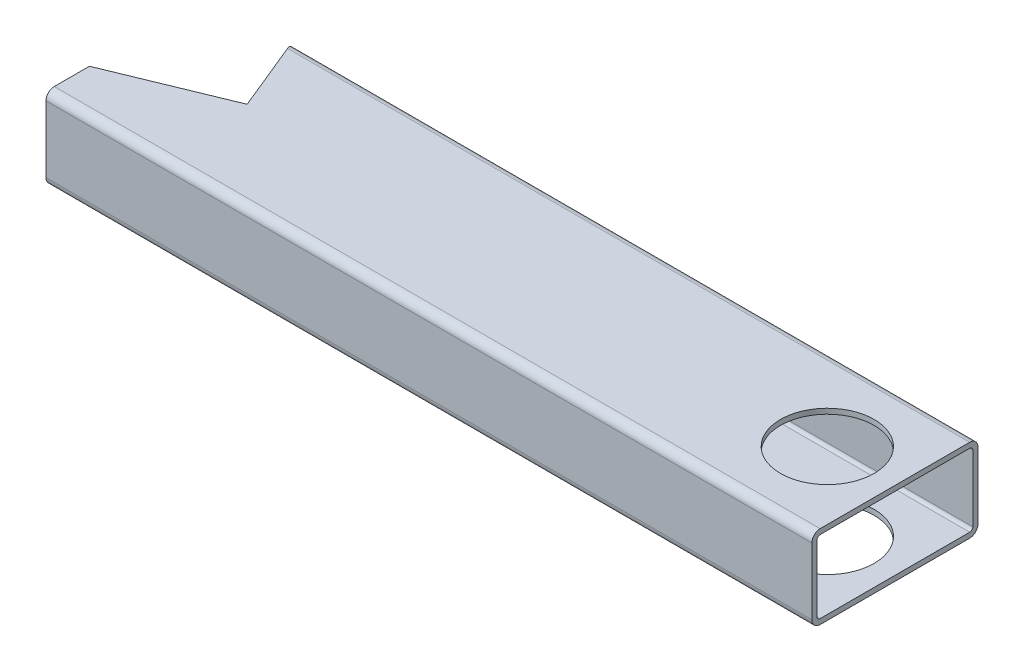
from build123d import *

# Parameters (mm, degrees)
EXTRUDE_THIN1_DEPTH     = 243.6368
CUT_EXTRUDE1_DEPTH      = 251.169323288
CUT_EXTRUDE1_DEPTH_BACK = 251.169323288
SKETCH4_R               = 14.3129


with BuildPart() as part:
    # Sketch1 → Extrude-Thin1 (new body)
    with BuildSketch(Plane(origin=(0, 0, 0), x_dir=(0, 0, -1), z_dir=(1, 0, 0))):
        with BuildLine():
            Line((-48.26, 25.4), (-2.54, 25.4))
            ThreePointArc((-2.54, 25.4), (-0.743948776, 24.656051224), (0, 22.86))
            Line((0, 22.86), (0, 2.54))
            ThreePointArc((0, 2.54), (-0.743948776, 0.743948776), (-2.54, 0))
            Line((-2.54, 0), (-48.26, 0))
            ThreePointArc((-48.26, 0), (-50.056051224, 0.743948776), (-50.8, 2.54))
            Line((-50.8, 2.54), (-50.8, 22.86))
            ThreePointArc((-50.8, 22.86), (-50.056051224, 24.656051224), (-48.26, 25.4))
        make_face()
        with BuildLine():
            Line((-48.26, 23.8125), (-2.54, 23.8125))
            ThreePointArc((-2.54, 23.8125), (-1.866480791, 23.533519209), (-1.5875, 22.86))
            Line((-1.5875, 22.86), (-1.5875, 2.54))
            ThreePointArc((-1.5875, 2.54), (-1.866480791, 1.866480791), (-2.54, 1.5875))
            Line((-2.54, 1.5875), (-48.26, 1.5875))
            ThreePointArc((-48.26, 1.5875), (-48.933519209, 1.866480791), (-49.2125, 2.54))
            Line((-49.2125, 2.54), (-49.2125, 22.86))
            ThreePointArc((-49.2125, 22.86), (-48.933519209, 23.533519209), (-48.26, 23.8125))
        make_face(mode=Mode.SUBTRACT)
    extrude(amount=-EXTRUDE_THIN1_DEPTH)

    # Sketch4 → Cut-Extrude1 (cut, two sides: drawn at the far end of the back side and taken through both)
    with BuildSketch(Plane(origin=(0, 25.4, 0), x_dir=(1, 0, 0), z_dir=(0, 1, 0)).offset(-CUT_EXTRUDE1_DEPTH_BACK)):
        with Locations((-20.6629, -25.4)):
            Circle(SKETCH4_R)
        Polygon((-234.1118, -37.537258088), (-234.1118, -50.8), (-243.6368, -50.8), (-243.6368, 0), (-209.5754, 0), (-199.924910127, -23.495277083), align=None)
    extrude(amount=CUT_EXTRUDE1_DEPTH + CUT_EXTRUDE1_DEPTH_BACK, mode=Mode.SUBTRACT)


solid = part.part
